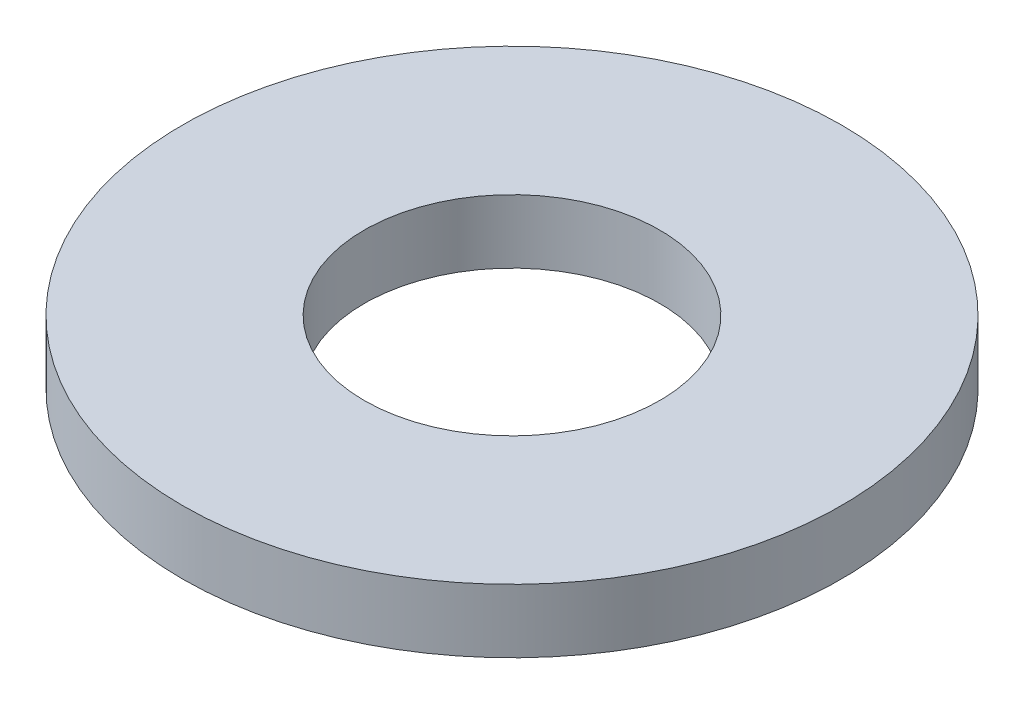
from build123d import *

# Parameters (mm, degrees)
SKETCH1_R           = 72.5
BOSS_EXTRUDE1_DEPTH = 14
SKETCH2_R           = 32.5
CUT_EXTRUDE1_DEPTH  = 104.481882472


with BuildPart() as part:
    # Sketch1 → Boss-Extrude1 (new body)
    with BuildSketch(Plane(origin=(0, 0, 0), x_dir=(1, 0, 0), z_dir=(0, 1, 0))):
        Circle(SKETCH1_R)
    extrude(amount=BOSS_EXTRUDE1_DEPTH)

    # Sketch2 → Cut-Extrude1 (cut, through all)
    with BuildSketch(Plane(origin=(0, 0, 0), x_dir=(1, 0, 0), z_dir=(0, 1, 0))):
        Circle(SKETCH2_R)
    extrude(amount=CUT_EXTRUDE1_DEPTH, mode=Mode.SUBTRACT)


solid = part.part
